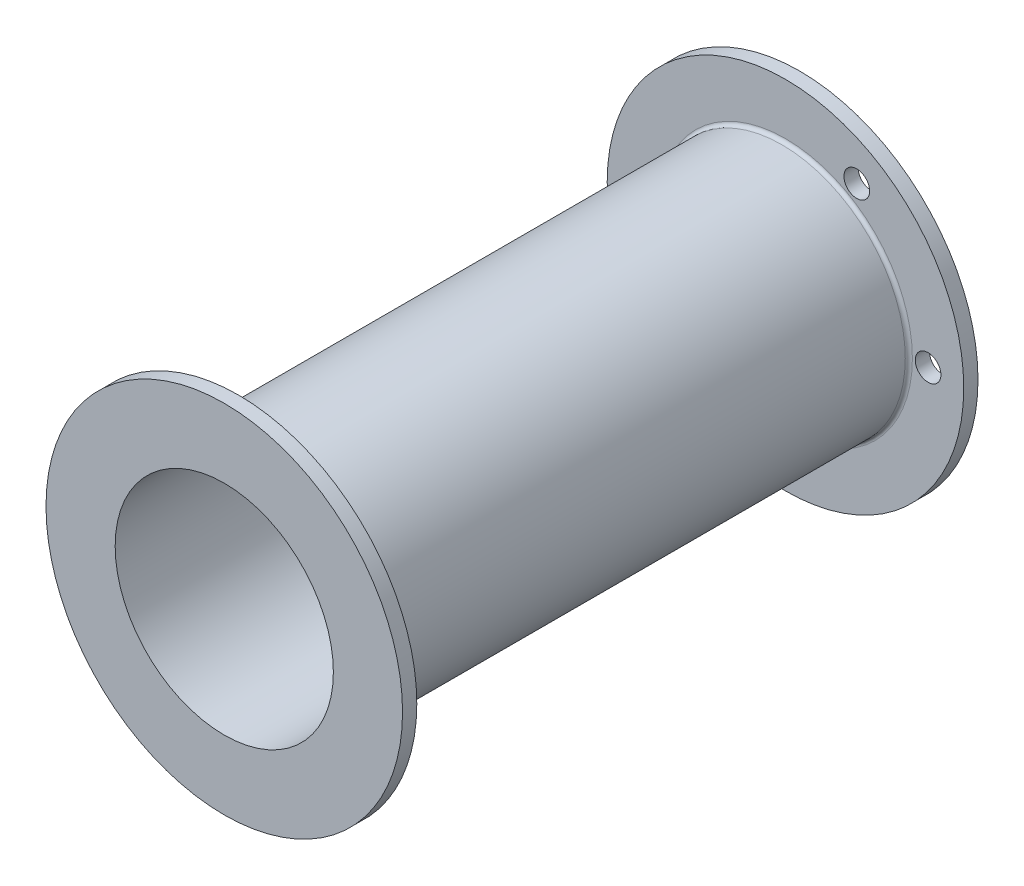
from build123d import *
from build123d.topology import SkipClean

# Parameters (mm, degrees)
SKETCH1_R           = 8.65
SKETCH1_R_2         = 7.65
BOSS_EXTRUDE1_DEPTH = 39.35
BOSS_EXTRUDE2_START = 1
SKETCH2_R           = 12.5
SKETCH2_R_2         = 7.65
BOSS_EXTRUDE2_DEPTH = 1
CIRPATTERN1_COUNT   = 6
FILLET1_R           = 0.25


with BuildPart() as part:
    # Sketch1 → Boss-Extrude1 (new body)
    with BuildSketch(Plane.XY):
        Circle(SKETCH1_R)
        Circle(SKETCH1_R_2, mode=Mode.SUBTRACT)
    extrude(amount=BOSS_EXTRUDE1_DEPTH)

    # Sketch2 → Boss-Extrude2 (add)
    with SkipClean():  # the faces are left unmerged after this step: merging them gives an invalid solid
        with BuildSketch(Plane(origin=(0, 0, 0), x_dir=(-1, 0, 0), z_dir=(0, 0, -1)).offset(BOSS_EXTRUDE2_START)):
            Circle(SKETCH2_R)
            Circle(SKETCH2_R_2, mode=Mode.SUBTRACT)
        boss_extrude2 = extrude(amount=-BOSS_EXTRUDE2_DEPTH)

    # Sketch11 → M1.6 Clearance Hole1 (revolve, cut)
    with SkipClean():  # the faces are left unmerged after this step: merging them gives an invalid solid
        with BuildSketch(Plane(origin=(-10, 0, 0), x_dir=(0, -1, 0), z_dir=(1, 0, 0))):
            Polygon((0, 0), (0, 5.540774557), (0.9, 5), (0.9, 0), align=None)
        m1_6_clearance_hole1 = revolve(axis=Axis((-10, 0, 6.35), (0, 0, -1)), mode=Mode.SUBTRACT)

    # CirPattern1: M1.6 Clearance Hole1 ×6 about axis, 2 skipped
    with SkipClean():  # the faces are left unmerged after this step: merging them gives an invalid solid
        cirpattern1_axis = Axis((0, 0, 0), (0, 0, -1))
        add([m1_6_clearance_hole1.rotate(cirpattern1_axis, i * 360 / CIRPATTERN1_COUNT) for i in range(1, CIRPATTERN1_COUNT) if i not in (1, 4)], mode=Mode.SUBTRACT)

    # Fillet1
    fillet1_edges = [part.edges().sort_by_distance(p)[0] for p in [
        (-8.65, 0, 0),
    ]]
    fillet(fillet1_edges, radius=FILLET1_R)

    # Mirror1: Boss-Extrude2 across plane
    add(boss_extrude2.mirror(Plane.XY.offset(19.175)))


solid = part.part
